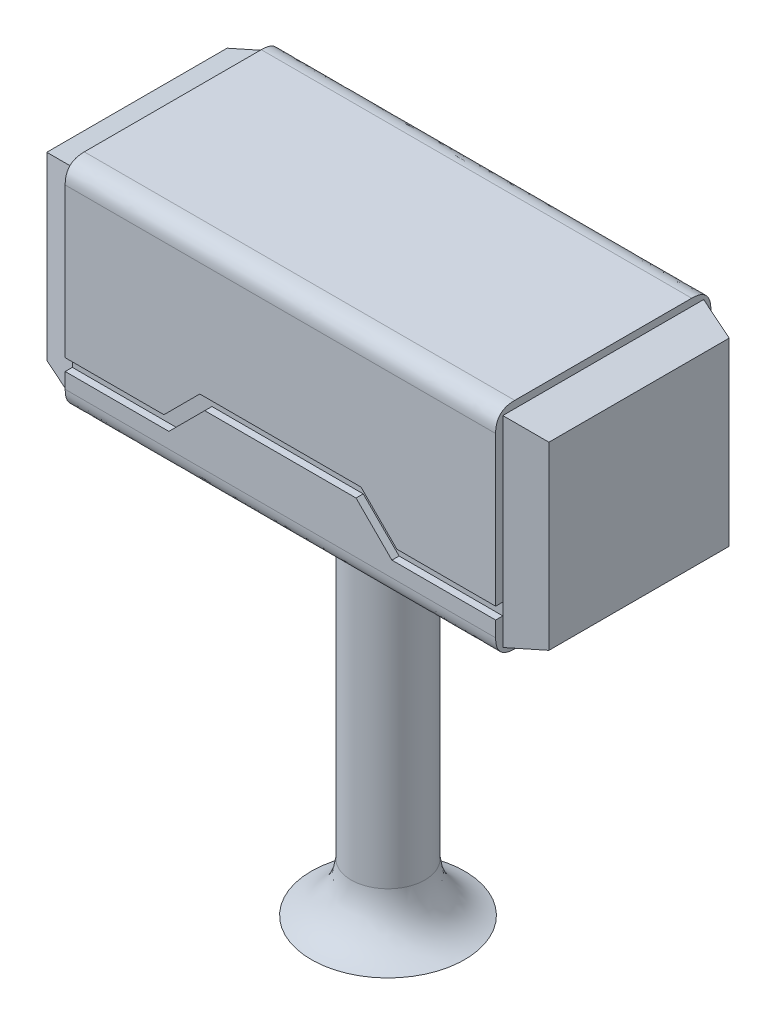
from build123d import *

# Parameters (mm, degrees)
SKETCH_1_W          = 180
SKETCH_1_H          = 90
EXTRUDE_1_DEPTH     = 45
SKETCH_3_W          = 84
SKETCH_3_H          = 84
EXTRUDE_3_DEPTH     = 15
EXTRUDE_3_TAPER     = 16
CUT_EXTRUDE_1_DEPTH = 3
FILLET_1_SIZE       = 8


with BuildPart() as part:
    # 草图1 → 凸台-拉伸1 (new, symmetric)
    with BuildSketch(Plane.XY):
        Rectangle(SKETCH_1_W, SKETCH_1_H)
    extrude(amount=EXTRUDE_1_DEPTH, both=True)

    # 草图3 → 凸台-拉伸3 (add)
    with BuildSketch(Plane(origin=(90, 0, 0), x_dir=(0, 0, -1), z_dir=(1, 0, 0))):
        Rectangle(SKETCH_3_W, SKETCH_3_H)
    extrude_3 = extrude(amount=EXTRUDE_3_DEPTH, taper=EXTRUDE_3_TAPER)

    # 镜向2: 凸台-拉伸3 across plane
    add(extrude_3.mirror(Plane(origin=(0, 0, 0), x_dir=(0, 0, 1), z_dir=(1, 0, 0))))

    # 草图5 → 切除-拉伸1 (cut)
    with BuildSketch(Plane(origin=(0, 0, -45), x_dir=(-1, 0, 0), z_dir=(0, 0, -1))):
        Polygon((-90, -25.551009309), (-48.710009236, -25.551009309), (-33.70706091, -10.548060984), (33.70706091, -10.548060984), (48.710009236, -25.551009309), (90, -25.551009309), (90, -30.551009309), (46.638941424, -30.551009309), (31.635993099, -15.548060984), (-31.635993099, -15.548060984), (-46.638941424, -30.551009309), (-90, -30.551009309), align=None)
    cut_extrude_1 = extrude(amount=-CUT_EXTRUDE_1_DEPTH, mode=Mode.SUBTRACT)

    # 镜向3: 切除-拉伸1 across plane
    add(cut_extrude_1.mirror(Plane.XY), mode=Mode.SUBTRACT)

    # 圆角1
    # a fillet whose section is not a circle: 8 mm, written as the material it takes off along each edge
    with BuildSketch(Plane(origin=(110, -45, -45), x_dir=(0, 0, 1), z_dir=(-1, 0, 0)), Plane(origin=(-110, 45, -45), x_dir=(0, 0, 1), z_dir=(1, 0, 0))) as fillet_1_piece_1:
        with BuildLine():
            Bezier((FILLET_1_SIZE, 0), (0, 0), (0, FILLET_1_SIZE), weights=[1, 1, 1])
            Line((0, FILLET_1_SIZE), (0, 0))
            Line((0, 0), (FILLET_1_SIZE, 0))
        make_face()
    extrude(amount=220, mode=Mode.SUBTRACT)
    with BuildSketch(Plane(origin=(-110, 45, 45), x_dir=(0, 0, -1), z_dir=(1, 0, 0)), Plane(origin=(110, -45, 45), x_dir=(0, 0, -1), z_dir=(-1, 0, 0))) as fillet_1_piece_2:
        with BuildLine():
            Bezier((FILLET_1_SIZE, 0), (0, 0), (0, -FILLET_1_SIZE), weights=[1, 1, 1])
            Line((0, -FILLET_1_SIZE), (0, 0))
            Line((0, 0), (FILLET_1_SIZE, 0))
        make_face()
    extrude(amount=220, mode=Mode.SUBTRACT)

    # 草图16 → 旋转1 (revolve)
    with BuildSketch(Plane.XY, mode=Mode.PRIVATE) as revolve_1_sk:
        with BuildLine():
            Line((0, -45), (0, -205.026171576))
            Line((0, -205.026171576), (32.069336895, -205.026171576))
            add(Edge.make_bspline(
                [(15.434694719, -184.505349345), (16.976260644, -200.431842868), (32.069336895, -205.026171576)],
                knots=[0, 0, 0, 1, 1, 1], degree=2))
            Line((15.434694719, -184.505349345), (15.434694719, -45))
            Line((15.434694719, -45), (0, -45))
        make_face()
    revolve(revolve_1_sk.sketch.rotate(Axis((0, -45, 0), (0, -1, 0)), 180), axis=Axis((0, -45, 0), (0, -1, 0)))


solid = part.part
